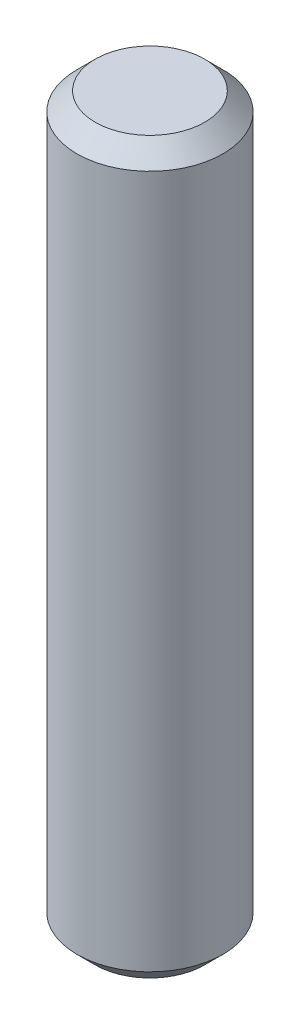
from build123d import *

# Parameters (mm, degrees)
SKETCH1_R           = 2
BOSS_EXTRUDE1_DEPTH = 20
CHAMFER1_SIZE       = 0.5


with BuildPart() as part:
    # Sketch1 → Boss-Extrude1 (new body)
    with BuildSketch(Plane(origin=(0, 0, 0), x_dir=(1, 0, 0), z_dir=(0, 1, 0))):
        Circle(SKETCH1_R)
    extrude(amount=BOSS_EXTRUDE1_DEPTH)

    # Chamfer1
    chamfer1_edges = [part.edges().sort_by_distance(p)[0] for p in [
        (-2, 0, 0),
        (-2, 20, 0),
    ]]
    chamfer(chamfer1_edges, length=CHAMFER1_SIZE)


solid = part.part
